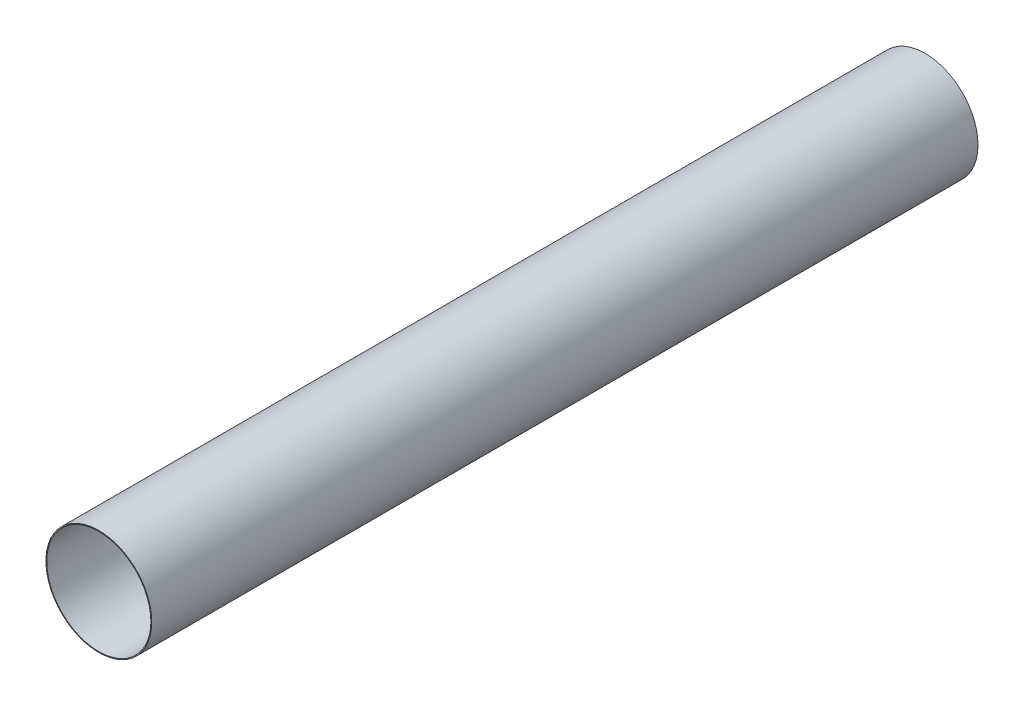
from build123d import *

# Parameters (mm, degrees)
ESQUISSE1_R        = 76.182
ESQUISSE1_R_2      = 75
BOSS_EXTRU_1_DEPTH = 1190


with BuildPart() as part:
    # Esquisse1 → Boss.-Extru.1 (new body)
    with BuildSketch(Plane.XY):
        Circle(ESQUISSE1_R)
        Circle(ESQUISSE1_R_2, mode=Mode.SUBTRACT)
    extrude(amount=BOSS_EXTRU_1_DEPTH)


solid = part.part
